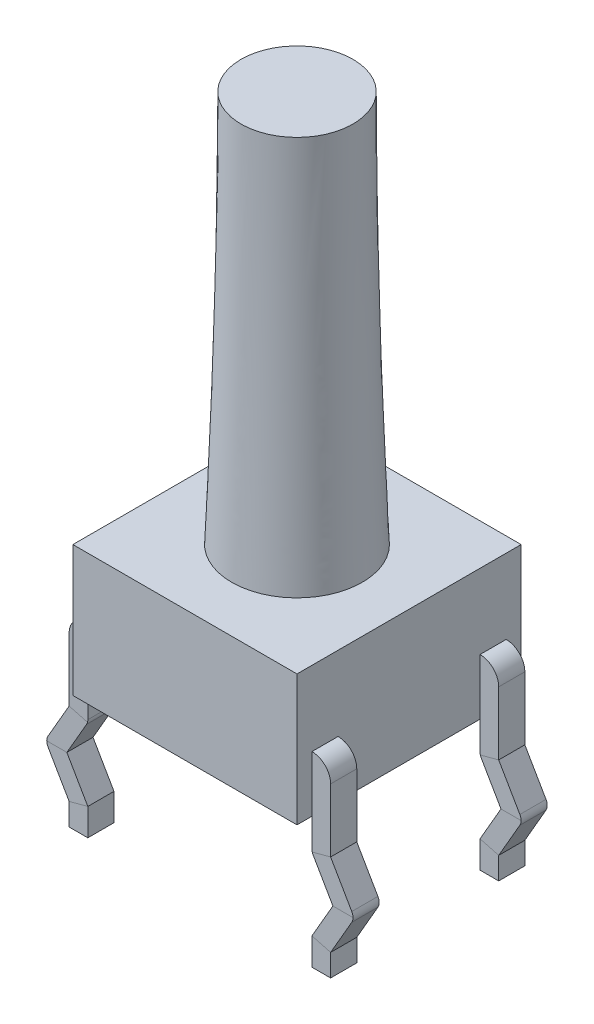
from build123d import *

# Parameters (mm, degrees)
SKETCH1_W           = 6
SKETCH1_H           = 6
BOSS_EXTRUDE1_DEPTH = 3.5
SKETCH1_3_W         = 0.5
SKETCH1_3_H         = 0.7
BOSS_EXTRUDE2_DEPTH = 1.5
FILLET1_R           = 0.5
SKETCH10_W          = 0.5
SKETCH10_H          = 0.7
FILLET2_R           = 0.25


with BuildPart() as part:
    # Sketch1 → Boss-Extrude1 (new body)
    with BuildSketch(Plane(origin=(0, 0, 0), x_dir=(1, 0, 0), z_dir=(0, 1, 0))):
        Rectangle(SKETCH1_W, SKETCH1_H)
    extrude(amount=BOSS_EXTRUDE1_DEPTH)

    # Loft1: read off the stored shape, not the designer's step
    # Loft1: loft between two sections, ruled curve by curve
    loft1_from = [
        Edge.make_bspline([(-1.552212541, 3.5, 0.80816844), (0.064124339, 3.5, 3.912593522), (3.168549421, 3.5, 2.296256642), (1.552212541, 3.5, -0.80816844), (-0.064124339, 3.5, -3.912593522), (-3.168549421, 3.5, -2.296256642), (-1.552212541, 3.5, 0.80816844)], [0, 0, 0, 0, 0.5, 0.5, 0.5, 1, 1, 1, 1], 3, [1, 0.333333333, 0.333333333, 1, 0.333333333, 0.333333333, 1]),
    ]
    loft1_to = [
        Edge.make_bspline([(-0.81326638, 14, 1.260395888), (1.707525396, 14, 2.886928648), (3.334058157, 14, 0.366136872), (0.81326638, 14, -1.260395888), (-1.707525396, 14, -2.886928648), (-3.334058157, 14, -0.366136872), (-0.81326638, 14, 1.260395888)], [0, 0, 0, 0, 0.5, 0.5, 0.5, 1, 1, 1, 1], 3, [1, 0.333333333, 0.333333333, 1, 0.333333333, 0.333333333, 1]),
    ]
    loft1 = Solid(Shell([*[Face.make_surface_from_curves(loft1_from[k], loft1_to[k]) for k in range(1)], Face(Wire(loft1_from)), Face(Wire(loft1_to))]))
    add(loft1)

    # Sketch1<3> → Boss-Extrude2 (add)
    with BuildSketch(Plane(origin=(0, 0, 0), x_dir=(1, 0, 0), z_dir=(0, 1, 0))):
        with Locations((3.25, -2.25)):
            Rectangle(SKETCH1_3_W, SKETCH1_3_H)
        with Locations((3.25, 2.25)):
            Rectangle(SKETCH1_3_W, SKETCH1_3_H)
        with Locations((-3.25, 2.25)):
            Rectangle(SKETCH1_3_W, SKETCH1_3_H)
        with Locations((-3.25, -2.25)):
            Rectangle(SKETCH1_3_W, SKETCH1_3_H)
    extrude(amount=BOSS_EXTRUDE2_DEPTH)

    # Fillet1
    fillet1_edges = [part.edges().sort_by_distance(p)[0] for p in [
        (3.5, 1.5, 2.25),
        (3.5, 1.5, -2.25),
        (-3.5, 1.5, 2.25),
        (-3.5, 1.5, -2.25),
    ]]
    fillet(fillet1_edges, radius=FILLET1_R - 0.0001)  # a hair under: the kernel refuses the full size

    # Sweep5: sweep along a path in Sketch8
    with BuildLine(Plane.XY.offset(2.3)) as sweep5_path:
        Line((3.25, 0), (3.25, -0.760769515))
        Line((3.25, -0.760769515), (3.85, -1.8))
        Line((3.85, -1.8), (3.25, -2.839230485))
        Line((3.25, -2.839230485), (3.25, -3.5))
    # Sketch10 → Sweep5 (sweep)
    with BuildSketch(Plane(origin=(0, -3.5, 0), x_dir=(-1, 0, 0), z_dir=(0, -1, 0))):
        with Locations((-3.25, 2.25)):
            Rectangle(SKETCH10_W, SKETCH10_H)
        with Locations((-3.25, -2.25)):
            Rectangle(SKETCH10_W, SKETCH10_H)
    sweep5 = sweep(path=sweep5_path.line, transition=Transition.RIGHT)

    # Mirror1: Sweep5 across plane
    add(sweep5.mirror(Plane(origin=(0, 0, 0), x_dir=(0, 0, 1), z_dir=(1, 0, 0))))

    # Fillet2
    fillet2_edges = [part.edges().sort_by_distance(p)[0] for p in [
        (4.138675135, -1.8, -2.25),
        (3, -0.827756814, -2.25),
        (4.138675135, -1.8, 2.25),
        (3, -0.827756814, 2.25),
        (-4.138675135, -1.8, -2.25),
        (-3, -0.827756814, -2.25),
        (-4.138675135, -1.8, 2.25),
        (-3, -0.827756814, 2.25),
    ]]
    fillet(fillet2_edges, radius=FILLET2_R)


solid = part.part
